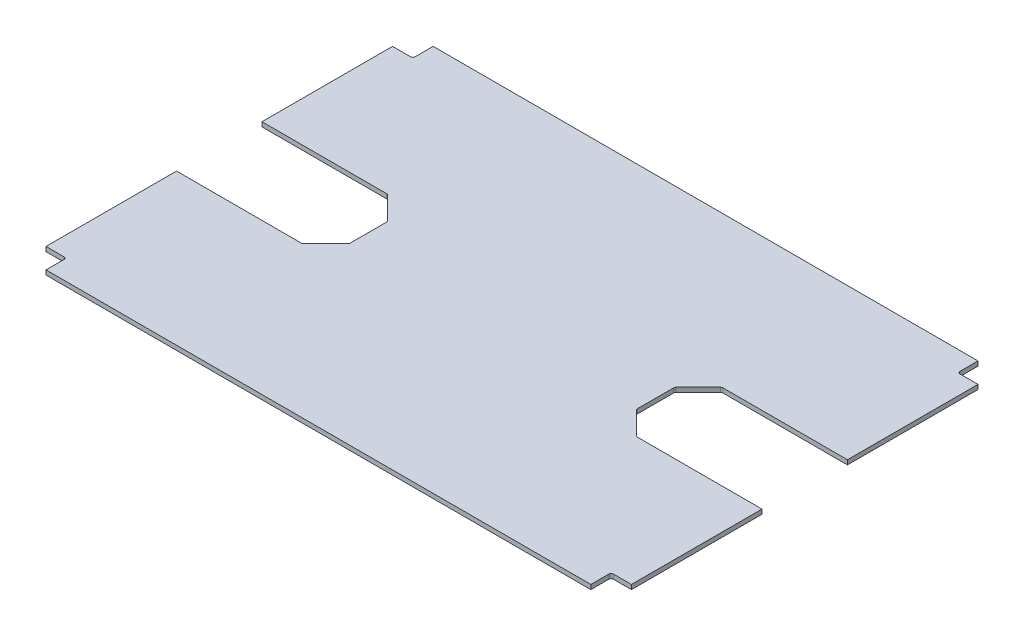
from build123d import *

# Parameters (mm, degrees)
BOSS_EXTRUDE1_DEPTH = 9.525
CHAMFER1_SIZE       = 50
FILLET2_R           = 5


with BuildPart() as part:
    # Sketch1 → Boss-Extrude1 (new body)
    with BuildSketch(Plane(origin=(0, 0, 0), x_dir=(1, 0, 0), z_dir=(0, 1, 0))):
        Polygon((-620, 367), (-620, 90.5), (-304, 90.5), (-304, -90.5), (-620, -90.5), (-620, -367), (-577, -367), (-577, -410), (577, -410), (577, -367), (620, -367), (620, -90.5), (304, -90.5), (304, 90.5), (620, 90.5), (620, 367), (577, 367), (577, 410), (-577, 410), (-577, 367), align=None)
    extrude(amount=BOSS_EXTRUDE1_DEPTH)

    # Chamfer1
    chamfer1_edges = [part.edges().sort_by_distance(p)[0] for p in [
        (304, 4.7625, 90.5),
        (304, 4.7625, -90.5),
        (-304, 4.7625, 90.5),
        (-304, 4.7625, -90.5),
    ]]
    chamfer(chamfer1_edges, length=CHAMFER1_SIZE)

    # Fillet2
    fillet2_edges = [part.edges().sort_by_distance(p)[0] for p in [
        (577, 4.7625, -367),
        (577, 4.7625, 367),
        (-577, 4.7625, 367),
        (-577, 4.7625, -367),
        (304, 4.7625, -40.5),
        (304, 4.7625, 40.5),
        (354, 4.7625, 90.5),
        (354, 4.7625, -90.5),
        (-354, 4.7625, 90.5),
        (-304, 4.7625, 40.5),
        (-304, 4.7625, -40.5),
        (-354, 4.7625, -90.5),
    ]]
    fillet(fillet2_edges, radius=FILLET2_R)


solid = part.part
